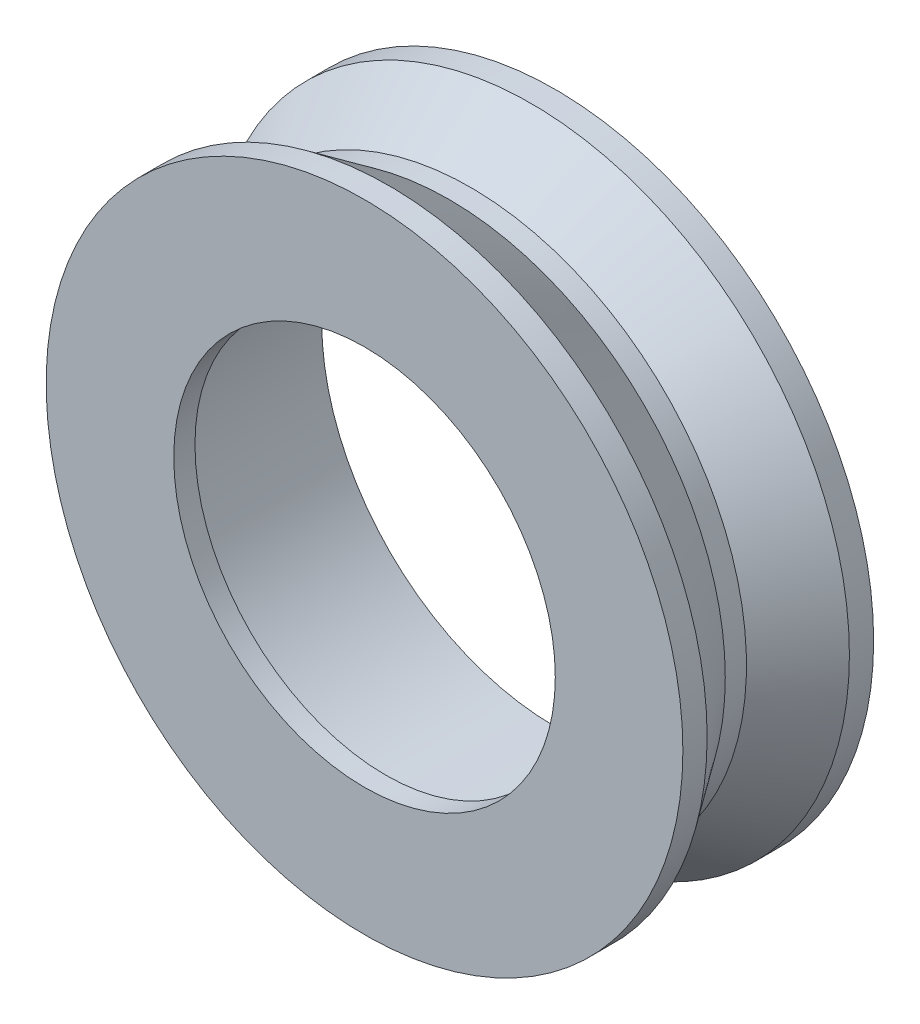
from build123d import *

# Parameters (mm, degrees)
SKETCH2_R               = 13.02
SKETCH2_R_2             = 11.02
BOSS_EXTRUDE1_DEPTH     = 7
SKETCH3_R               = 15.02
SKETCH3_R_2             = 13.02
SKETCH3_R_3             = 11.02
SKETCH3_R_4             = 9
BOSS_EXTRUDE2_DEPTH     = 1
SALIENTE_EXTRUIR1_START = -8
SKETCH3_2_R             = 15.02
SKETCH3_2_R_2           = 13.02
SKETCH3_2_R_3           = 11.02
SALIENTE_EXTRUIR1_DEPTH = 1
CHAFL_N1_SIZE           = 3
CHAFL_N1_SIZE_2         = 2.100622615
CHAMFER1_SIZE           = 3
CHAMFER1_SIZE_2         = 2.100622615


with BuildPart() as part:
    # Sketch2 → Boss-Extrude1 (new body)
    with BuildSketch(Plane.XY):
        Circle(SKETCH2_R)
        Circle(SKETCH2_R_2, mode=Mode.SUBTRACT)
    extrude(amount=BOSS_EXTRUDE1_DEPTH)

    # Sketch3 → Boss-Extrude2 (add)
    # profile 1 of 3: a face of its own
    with BuildSketch(Plane.XY.offset(7)):
        Circle(SKETCH3_R)
        Circle(SKETCH3_R_2, mode=Mode.SUBTRACT)
    # profile 2 of 3: a face of its own
    with BuildSketch(Plane.XY.offset(7)):
        Circle(SKETCH3_R_2)
        Circle(SKETCH3_R_3, mode=Mode.SUBTRACT)
    # profile 3 of 3: a face of its own
    with BuildSketch(Plane.XY.offset(7)):
        Circle(SKETCH3_R_3)
        Circle(SKETCH3_R_4, mode=Mode.SUBTRACT)
    extrude(amount=BOSS_EXTRUDE2_DEPTH)

    # Sketch3<2> → Saliente-Extruir1 (add)
    # profile 1 of 2: a face of its own
    with BuildSketch(Plane.XY.offset(7).offset(SALIENTE_EXTRUIR1_START)):
        Circle(SKETCH3_2_R)
        Circle(SKETCH3_2_R_2, mode=Mode.SUBTRACT)
    # profile 2 of 2: a face of its own
    with BuildSketch(Plane.XY.offset(7).offset(SALIENTE_EXTRUIR1_START)):
        Circle(SKETCH3_2_R_2)
        Circle(SKETCH3_2_R_3, mode=Mode.SUBTRACT)
    extrude(amount=SALIENTE_EXTRUIR1_DEPTH)

    # Chaflán1
    # the kernel refuses this chamfer: 3, 2.100622615 mm, written as the material it adds along each edge
    with BuildSketch(Plane(origin=(0, 0, 7), x_dir=(1, 0, 0), z_dir=(0, -1, 0))) as chafl_n1_piece_1_section:
        Polygon((13.02, -CHAFL_N1_SIZE), (13.02 + CHAFL_N1_SIZE_2, 0), (13.02, 0), align=None)
    chafl_n1_piece_1 = revolve(axis=Axis((0, 0, 7), (0, 0, 1)), mode=Mode.PRIVATE)
    chafl_n1_piece_1 = chafl_n1_piece_1 & Plane(origin=(0, 0, 5.417457175), x_dir=(1, 0, 0), z_dir=(0, 0, -1)) * Cylinder(15.02, 61, mode=Mode.PRIVATE)
    add(chafl_n1_piece_1)

    # Chamfer1
    # the kernel refuses this chamfer: 3, 2.100622615 mm, written as the material it adds along each edge
    with BuildSketch(Plane(origin=(0, 0, 0), x_dir=(1, 0, 0), z_dir=(0, -1, 0))) as chamfer1_piece_1_section:
        Polygon((13.02, CHAMFER1_SIZE), (13.02 + CHAMFER1_SIZE_2, 0), (13.02, 0), align=None)
    chamfer1_piece_1 = revolve(axis=Axis((0, 0, 0), (0, 0, 1)), mode=Mode.PRIVATE)
    chamfer1_piece_1 = chamfer1_piece_1 & Plane(origin=(0, 0, 1.582542825), x_dir=(1, 0, 0), z_dir=(0, 0, -1)) * Cylinder(15.02, 61, mode=Mode.PRIVATE)
    add(chamfer1_piece_1)


solid = part.part
